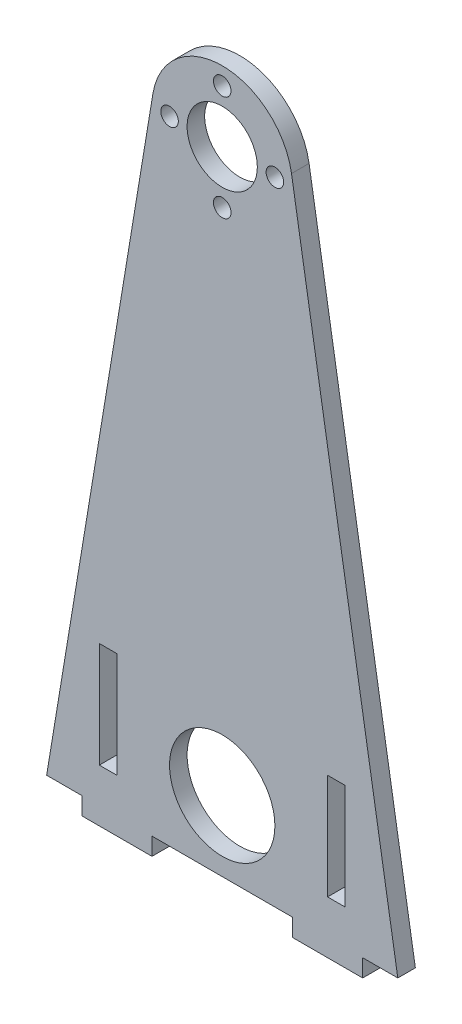
from build123d import *

# Parameters (mm, degrees)
SKETCH1_R           = 12.7
SKETCH1_R_2         = 3.175
SKETCH1_R_3         = 19.05
SKETCH1_W           = 6.35
SKETCH1_H           = 38.1
BOSS_EXTRUDE1_DEPTH = 6.35


with BuildPart() as part:
    # Sketch1 → Boss-Extrude1 (new body)
    with BuildSketch(Plane.XY):
        with BuildLine():
            Line((25.4, 0), (-25.4, 0))
            Line((-25.4, 0), (-25.4, -6.35))
            Line((-25.4, -6.35), (-50.8, -6.35))
            Line((-50.8, -6.35), (-50.8, 0))
            Line((-50.8, 0), (-63.5, 0))
            Line((-63.5, 0), (-25.060495971, 232.739026659))
            ThreePointArc((-25.060495971, 232.739026659), (0, 254), (25.060495971, 232.739026659))
            Line((25.060495971, 232.739026659), (63.5, 0))
            Line((63.5, 0), (50.8, 0))
            Line((50.8, 0), (50.8, -6.35))
            Line((50.8, -6.35), (25.4, -6.35))
            Line((25.4, -6.35), (25.4, 0))
        make_face()
        with Locations((0, 228.6)):
            Circle(SKETCH1_R, mode=Mode.SUBTRACT)
        with Locations((0, 247.65)):
            Circle(SKETCH1_R_2, mode=Mode.SUBTRACT)
        with Locations((19.05, 228.6)):
            Circle(SKETCH1_R_2, mode=Mode.SUBTRACT)
        with Locations((0, 209.55)):
            Circle(SKETCH1_R_2, mode=Mode.SUBTRACT)
        with Locations((-19.05, 228.6)):
            Circle(SKETCH1_R_2, mode=Mode.SUBTRACT)
        with Locations((0, 25.4)):
            Circle(SKETCH1_R_3, mode=Mode.SUBTRACT)
        with Locations((41.275, 31.75)):
            Rectangle(SKETCH1_W, SKETCH1_H, mode=Mode.SUBTRACT)
        with Locations((-41.275, 31.75)):
            Rectangle(SKETCH1_W, SKETCH1_H, mode=Mode.SUBTRACT)
    extrude(amount=BOSS_EXTRUDE1_DEPTH)


solid = part.part
